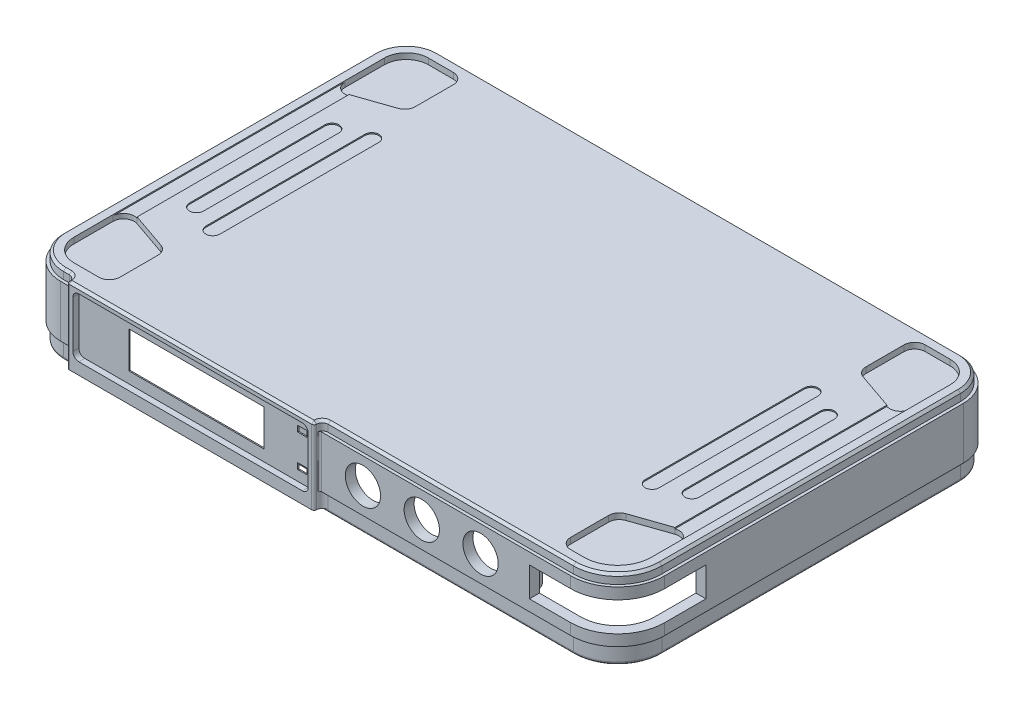
from build123d import *

# Parameters (mm, degrees)
BOSS_EXTRUDE1_DEPTH = 13
CUT_EXTRUDE1_DEPTH  = 1
CUT_EXTRUDE2_DEPTH  = 0.2
CUT_EXTRUDE3_START  = -1.6
CUT_EXTRUDE3_DEPTH  = 1.6
CUT_EXTRUDE4_DEPTH  = 2.6
SKETCH7_W           = 42
SKETCH7_H           = 13
BOSS_EXTRUDE2_DEPTH = 1.4
CUT_EXTRUDE6_DEPTH  = 0.5
CUT_EXTRUDE7_DEPTH  = 1
SKETCH10_R          = 6.5
CUT_EXTRUDE8_DEPTH  = 0.5
FILLET1_R           = 0.4
FILLET2_R           = 1
CHAMFER1_SIZE       = 0.4
CUT_EXTRUDE9_DEPTH  = 11.5
SKETCH12_W          = 23
SKETCH12_H          = 6.2
SKETCH12_W_2        = 1.6
SKETCH12_H_2        = 1
CUT_EXTRUDE10_DEPTH = 12
SKETCH13_R          = 4.5
CUT_EXTRUDE11_DEPTH = 12
SKETCH14_R          = 2.25
CUT_EXTRUDE12_DEPTH = 12
SKETCH15_R          = 3
SKETCH15_W          = 15
SKETCH15_H          = 5
CUT_EXTRUDE13_DEPTH = 15
BOSS_EXTRUDE5_DEPTH = 2.2
SKETCH18_R          = 0.8
SKETCH18_W          = 5.6
SKETCH18_H          = 3
BOSS_EXTRUDE6_DEPTH = 8.5
FILLET4_R           = 0.8
FILLET5_R           = 2
FILLET6_R           = 1
SKETCH19_R          = 0.6
BOSS_EXTRUDE7_DEPTH = 1.4
CHAMFER2_SIZE       = 0.4
SKETCH20_W          = 1.6
SKETCH20_H          = 1
CUT_EXTRUDE14_DEPTH = 1.1
BOSS_EXTRUDE8_DEPTH = 1
BOSS_EXTRUDE9_START = 0.5
BOSS_EXTRUDE9_DEPTH = 0.5
FILLET7_R           = 0.5


# Some blends are built 0.0001 mm under size
with BuildPart() as part:
    # Sketch1 → Boss-Extrude1 (new body)
    with BuildSketch(Plane(origin=(0, 0, 0), x_dir=(1, 0, 0), z_dir=(0, 1, 0))):
        with BuildLine():
            Line((44.35, 32.39), (-44.35, 32.39))
            ThreePointArc((-44.35, 32.39), (-48.592640687, 30.632640687), (-50.35, 26.39))
            Line((-50.35, 26.39), (-50.35, -26.39))
            ThreePointArc((-50.35, -26.39), (-48.592640687, -30.632640687), (-44.35, -32.39))
            Line((-44.35, -32.39), (42.35, -32.39))
            ThreePointArc((42.35, -32.39), (48.006854249, -30.046854249), (50.35, -24.39))
            Line((50.35, -24.39), (50.35, 26.39))
            ThreePointArc((50.35, 26.39), (48.592640687, 30.632640687), (44.35, 32.39))
        make_face()
    extrude(amount=BOSS_EXTRUDE1_DEPTH)

    # Sketch3 → Cut-Extrude1 (cut)
    with BuildSketch(Plane(origin=(0, 13, 0), x_dir=(1, 0, 0), z_dir=(0, 1, 0))):
        with BuildLine():
            Line((-44.35, -30.13894271), (-40.09894271, -30.13894271))
            ThreePointArc((-40.09894271, -30.13894271), (-38.826150504, -29.611734916), (-38.29894271, -28.33894271))
            Line((-38.29894271, -28.33894271), (-38.29894271, -21.854017959))
            ThreePointArc((-38.29894271, -21.854017959), (-38.633270046, -20.809123878), (-39.512057867, -20.152381635))
            Line((-39.512057867, -20.152381635), (-45.712057867, -18.01403634))
            ThreePointArc((-45.712057867, -18.01403634), (-47.343836791, -18.25), (-48.09894271, -19.715672664))
            Line((-48.09894271, -19.715672664), (-48.09894271, -26.39))
            ThreePointArc((-48.09894271, -26.39), (-47.000902813, -29.040902813), (-44.35, -30.13894271))
        make_face()
        with BuildLine():
            ThreePointArc((48.09894271, -24.39), (46.415116375, -28.455116375), (42.35, -30.13894271))
            Line((42.35, -30.13894271), (40.09894271, -30.13894271))
            ThreePointArc((40.09894271, -30.13894271), (38.826150504, -29.611734916), (38.29894271, -28.33894271))
            Line((38.29894271, -28.33894271), (38.29894271, -21.854017959))
            ThreePointArc((38.29894271, -21.854017959), (38.633270046, -20.809123878), (39.512057867, -20.152381635))
            Line((39.512057867, -20.152381635), (45.712057867, -18.01403634))
            ThreePointArc((45.712057867, -18.01403634), (47.343836791, -18.25), (48.09894271, -19.715672664))
            Line((48.09894271, -19.715672664), (48.09894271, -24.39))
        make_face()
        with BuildLine():
            Line((44.35, 30.13894271), (40.09894271, 30.13894271))
            ThreePointArc((40.09894271, 30.13894271), (38.826150504, 29.611734916), (38.29894271, 28.33894271))
            Line((38.29894271, 28.33894271), (38.29894271, 21.854017959))
            ThreePointArc((38.29894271, 21.854017959), (38.633270046, 20.809123878), (39.512057867, 20.152381635))
            Line((39.512057867, 20.152381635), (45.712057867, 18.01403634))
            ThreePointArc((45.712057867, 18.01403634), (47.343836791, 18.25), (48.09894271, 19.715672664))
            Line((48.09894271, 19.715672664), (48.09894271, 26.39))
            ThreePointArc((48.09894271, 26.39), (47.000902813, 29.040902813), (44.35, 30.13894271))
        make_face()
        with BuildLine():
            ThreePointArc((-48.09894271, 26.39), (-47.000902813, 29.040902813), (-44.35, 30.13894271))
            Line((-44.35, 30.13894271), (-40.09894271, 30.13894271))
            ThreePointArc((-40.09894271, 30.13894271), (-38.826150504, 29.611734916), (-38.29894271, 28.33894271))
            Line((-38.29894271, 28.33894271), (-38.29894271, 21.854017959))
            ThreePointArc((-38.29894271, 21.854017959), (-38.633270046, 20.809123878), (-39.512057867, 20.152381635))
            Line((-39.512057867, 20.152381635), (-45.712057867, 18.01403634))
            ThreePointArc((-45.712057867, 18.01403634), (-47.343836791, 18.25), (-48.09894271, 19.715672664))
            Line((-48.09894271, 19.715672664), (-48.09894271, 26.39))
        make_face()
    extrude(amount=-CUT_EXTRUDE1_DEPTH, mode=Mode.SUBTRACT)

    # Sketch4 → Cut-Extrude2 (cut)
    with BuildSketch(Plane(origin=(0, 13, 0), x_dir=(1, 0, 0), z_dir=(0, 1, 0))):
        with BuildLine():
            Line((-48.09894271, 19.715672664), (-48.09894271, -19.715672664))
            ThreePointArc((-48.09894271, -19.715672664), (-47.343836791, -18.25), (-45.712057867, -18.01403634))
            Line((-45.712057867, -18.01403634), (-45.712057867, 18.01403634))
            ThreePointArc((-45.712057867, 18.01403634), (-47.343836791, 18.25), (-48.09894271, 19.715672664))
        make_face()
        with BuildLine():
            Line((-40.925173024, 11.506557578), (-40.925173024, -11.506557578))
            ThreePointArc((-40.925173024, -11.506557578), (-42.118615445, -12.7), (-43.312057867, -11.506557578))
            Line((-43.312057867, -11.506557578), (-43.312057867, 11.506557578))
            ThreePointArc((-43.312057867, 11.506557578), (-42.118615445, 12.7), (-40.925173024, 11.506557578))
        make_face()
        with BuildLine():
            Line((-36.13828818, 13.506557578), (-36.13828818, -13.506557578))
            ThreePointArc((-36.13828818, -13.506557578), (-37.331730602, -14.7), (-38.525173024, -13.506557578))
            Line((-38.525173024, -13.506557578), (-38.525173024, 13.506557578))
            ThreePointArc((-38.525173024, 13.506557578), (-37.331730602, 14.7), (-36.13828818, 13.506557578))
        make_face()
        with BuildLine():
            Line((40.925173024, 11.506557578), (40.925173024, -11.506557578))
            ThreePointArc((40.925173024, -11.506557578), (42.118615445, -12.7), (43.312057867, -11.506557578))
            Line((43.312057867, -11.506557578), (43.312057867, 11.506557578))
            ThreePointArc((43.312057867, 11.506557578), (42.118615445, 12.7), (40.925173024, 11.506557578))
        make_face()
        with BuildLine():
            Line((36.13828818, 13.506557578), (36.13828818, -13.506557578))
            ThreePointArc((36.13828818, -13.506557578), (37.331730602, -14.7), (38.525173024, -13.506557578))
            Line((38.525173024, -13.506557578), (38.525173024, 13.506557578))
            ThreePointArc((38.525173024, 13.506557578), (37.331730602, 14.7), (36.13828818, 13.506557578))
        make_face()
        with BuildLine():
            Line((45.712057867, 18.01403634), (45.712057867, -18.01403634))
            ThreePointArc((45.712057867, -18.01403634), (47.343836791, -18.25), (48.09894271, -19.715672664))
            Line((48.09894271, -19.715672664), (48.09894271, 19.715672664))
            ThreePointArc((48.09894271, 19.715672664), (47.343836791, 18.25), (45.712057867, 18.01403634))
        make_face()
    extrude(amount=-CUT_EXTRUDE2_DEPTH, mode=Mode.SUBTRACT)

    # Sketch5 → Cut-Extrude3 (cut)
    with BuildSketch(Plane(origin=(0, 13, 0), x_dir=(1, 0, 0), z_dir=(0, 1, 0)).offset(CUT_EXTRUDE3_START)):
        with BuildLine():
            Line((44.35, 32.39), (-44.35, 32.39))
            ThreePointArc((-44.35, 32.39), (-48.592640687, 30.632640687), (-50.35, 26.39))
            Line((-50.35, 26.39), (-50.35, -26.39))
            ThreePointArc((-50.35, -26.39), (-48.592640687, -30.632640687), (-44.35, -32.39))
            Line((-44.35, -32.39), (42.35, -32.39))
            ThreePointArc((42.35, -32.39), (48.006854249, -30.046854249), (50.35, -24.39))
            Line((50.35, -24.39), (50.35, 26.39))
            ThreePointArc((50.35, 26.39), (48.592640687, 30.632640687), (44.35, 32.39))
        make_face()
        with BuildLine():
            Line((44.35, 31.89), (-44.35, 31.89))
            ThreePointArc((-44.35, 31.89), (-48.239087297, 30.279087297), (-49.85, 26.39))
            Line((-49.85, 26.39), (-49.85, -26.39))
            ThreePointArc((-49.85, -26.39), (-48.239087297, -30.279087297), (-44.35, -31.89))
            Line((-44.35, -31.89), (42.35, -31.89))
            ThreePointArc((42.35, -31.89), (47.653300859, -29.693300859), (49.85, -24.39))
            Line((49.85, -24.39), (49.85, 26.39))
            ThreePointArc((49.85, 26.39), (48.239087297, 30.279087297), (44.35, 31.89))
        make_face(mode=Mode.SUBTRACT)
    extrude(amount=CUT_EXTRUDE3_DEPTH, mode=Mode.SUBTRACT)

    # Sketch6 → Cut-Extrude4 (cut)
    with BuildSketch(Plane.XZ):
        with BuildLine():
            Line((-44.35, -32.39), (44.35, -32.39))
            ThreePointArc((44.35, -32.39), (48.592640687, -30.632640687), (50.35, -26.39))
            Line((50.35, -26.39), (50.35, 24.39))
            ThreePointArc((50.35, 24.39), (48.006854249, 30.046854249), (42.35, 32.39))
            Line((42.35, 32.39), (-44.35, 32.39))
            ThreePointArc((-44.35, 32.39), (-48.592640687, 30.632640687), (-50.35, 26.39))
            Line((-50.35, 26.39), (-50.35, -26.39))
            ThreePointArc((-50.35, -26.39), (-48.592640687, -30.632640687), (-44.35, -32.39))
        make_face()
        with BuildLine():
            Line((49.85, -26.39), (49.85, 24.39))
            ThreePointArc((49.85, 24.39), (47.653300859, 29.693300859), (42.35, 31.89))
            Line((42.35, 31.89), (-44.35, 31.89))
            ThreePointArc((-44.35, 31.89), (-48.239087297, 30.279087297), (-49.85, 26.39))
            Line((-49.85, 26.39), (-49.85, -26.39))
            ThreePointArc((-49.85, -26.39), (-48.239087297, -30.279087297), (-44.35, -31.89))
            Line((-44.35, -31.89), (44.35, -31.89))
            ThreePointArc((44.35, -31.89), (48.239087297, -30.279087297), (49.85, -26.39))
        make_face(mode=Mode.SUBTRACT)
    extrude(amount=-CUT_EXTRUDE4_DEPTH, mode=Mode.SUBTRACT)

    # Sketch7 → Boss-Extrude2 (add)
    with BuildSketch(Plane.XY.offset(31.89)):
        with Locations((-21.35, 6.5)):
            Rectangle(SKETCH7_W, SKETCH7_H)
    extrude(amount=BOSS_EXTRUDE2_DEPTH)

    # Sketch8 → Cut-Extrude6 (cut)
    with BuildSketch(Plane.ZY.offset(49.85)):
        with BuildLine():
            ThreePointArc((-17.469215611, 11.4), (-15.790490193, 1.50112313), (-7.39, 7))
            ThreePointArc((-7.39, 7), (-7.89112313, 9.400490193), (-9.310784389, 11.4))
            Line((-9.310784389, 11.4), (-17.469215611, 11.4))
        make_face()
        with BuildLine():
            Line((-17.469215611, 11.4), (-9.310784389, 11.4))
            ThreePointArc((-9.310784389, 11.4), (-13.39, 13), (-17.469215611, 11.4))
        make_face()
        with BuildLine():
            ThreePointArc((17.469215611, 11.4), (13.39, 13), (9.310784389, 11.4))
            Line((9.310784389, 11.4), (17.469215611, 11.4))
        make_face()
        with BuildLine():
            Line((17.469215611, 11.4), (9.310784389, 11.4))
            ThreePointArc((9.310784389, 11.4), (10.989509807, 1.50112313), (19.39, 7))
            ThreePointArc((19.39, 7), (18.88887687, 9.400490193), (17.469215611, 11.4))
        make_face()
    extrude(amount=CUT_EXTRUDE6_DEPTH, mode=Mode.SUBTRACT)

    # Sketch9 → Cut-Extrude7 (cut)
    with BuildSketch(Plane.XY.offset(33.29)):
        with BuildLine():
            Line((-40.35, 12), (-2.35, 12))
            ThreePointArc((-2.35, 12), (-1.642893219, 11.707106781), (-1.35, 11))
            Line((-1.35, 11), (-1.35, 3))
            ThreePointArc((-1.35, 3), (-1.642893219, 2.292893219), (-2.35, 2))
            Line((-2.35, 2), (-40.35, 2))
            ThreePointArc((-40.35, 2), (-41.057106781, 2.292893219), (-41.35, 3))
            Line((-41.35, 3), (-41.35, 11))
            ThreePointArc((-41.35, 11), (-41.057106781, 11.707106781), (-40.35, 12))
        make_face()
    extrude(amount=-CUT_EXTRUDE7_DEPTH, mode=Mode.SUBTRACT)

    # Sketch10 → Cut-Extrude8 (cut)
    with BuildSketch(Plane(origin=(0, 0, -31.89), x_dir=(-1, 0, 0), z_dir=(0, 0, -1))):
        with Locations((33.85, 6.5)):
            Circle(SKETCH10_R)
        with BuildLine():
            Line((-23.85, 0), (-34.85, 0))
            ThreePointArc((-34.85, 0), (-41.35, 6.5), (-34.85, 13))
            Line((-34.85, 13), (-23.85, 13))
            ThreePointArc((-23.85, 13), (-17.35, 6.5), (-23.85, 0))
        make_face()
    extrude(amount=CUT_EXTRUDE8_DEPTH, mode=Mode.SUBTRACT)

    # Fillet1
    fillet1_edges = [part.edges().sort_by_distance(p)[0] for p in [
        (-0.35, 7, 32.39),
        (-42.35, 7, 32.39),
        (-0.35, 6.5, 33.29),
        (-42.35, 6.5, 33.29),
    ]]
    fillet(fillet1_edges, radius=FILLET1_R)

    # Fillet2
    fillet2_edges = [part.edges().sort_by_distance(p)[0] for p in [
        (-0.35, 12.2, 31.89),
    ]]
    fillet(fillet2_edges, radius=FILLET2_R - 0.0001)  # a hair under: the kernel refuses the full size
    fillet2_2_edges = [part.edges().sort_by_distance(p)[0] for p in [
        (-42.35, 12.2, 31.89),
    ]]
    fillet(fillet2_2_edges, radius=FILLET2_R - 0.0001)  # a hair under: the kernel refuses the full size

    # Chamfer1
    chamfer1_edges = [part.edges().sort_by_distance(p)[0] for p in [
        (48.239087297, 13, -30.279087297),
        (49.85, 13, -1),
        (47.653300859, 13, 29.693300859),
        (-43.84995, 13, 31.89),
        (-48.239087297, 13, 30.279087297),
        (-49.85, 13, 0),
        (-48.239087297, 13, -30.279087297),
        (0, 13, -31.89),
        (-21.35, 13, 33.29),
        (-0.467157288, 13, 33.172842712),
        (-42.232842712, 13, 33.172842712),
        (21.49995, 13, 31.89),
        (-0.057136071, 13, 32.182863929),
        (-42.642863929, 13, 32.182863929),
    ]]
    chamfer(chamfer1_edges, length=CHAMFER1_SIZE)

    # Sketch11 → Cut-Extrude9 (cut)
    with BuildSketch(Plane.XZ):
        with BuildLine():
            ThreePointArc((-43.35, 30.69), (-42.109032635, 31.073409788), (-41.300609847, 32.09))
            Line((-41.300609847, 32.09), (-1.399390153, 32.09))
            ThreePointArc((-1.399390153, 32.09), (-0.590967365, 31.073409788), (0.65, 30.69))
            Line((0.65, 30.69), (42.35, 30.69))
            ThreePointArc((42.35, 30.69), (46.804772721, 28.844772721), (48.65, 24.39))
            Line((48.65, 24.39), (48.65, -26.39))
            ThreePointArc((48.65, -26.39), (47.390559159, -29.430559159), (44.35, -30.69))
            Line((44.35, -30.69), (-44.35, -30.69))
            ThreePointArc((-44.35, -30.69), (-47.390559159, -29.430559159), (-48.65, -26.39))
            Line((-48.65, -26.39), (-48.65, 26.39))
            ThreePointArc((-48.65, 26.39), (-47.390559159, 29.430559159), (-44.35, 30.69))
            Line((-44.35, 30.69), (-43.35, 30.69))
        make_face()
    extrude(amount=-CUT_EXTRUDE9_DEPTH, mode=Mode.SUBTRACT)

    # Sketch12 → Cut-Extrude10 (cut)
    with BuildSketch(Plane.XY.offset(32.29)):
        with Locations((-21.35, 7)):
            Rectangle(SKETCH12_W, SKETCH12_H)
        with Locations((-3.35, 9.75)):
            Rectangle(SKETCH12_W_2, SKETCH12_H_2)
        with Locations((-3.35, 4.25)):
            Rectangle(SKETCH12_W_2, SKETCH12_H_2)
    extrude(amount=-CUT_EXTRUDE10_DEPTH, mode=Mode.SUBTRACT)

    # Sketch13 → Cut-Extrude11 (cut)
    with BuildSketch(Plane.ZY.offset(49.85)):
        with Locations((-13.39, 7)):
            Circle(SKETCH13_R)
        with Locations((13.39, 7)):
            Circle(SKETCH13_R)
    extrude(amount=-CUT_EXTRUDE11_DEPTH, mode=Mode.SUBTRACT)

    # Sketch14 → Cut-Extrude12 (cut)
    with BuildSketch(Plane(origin=(0, 0, -31.89), x_dir=(-1, 0, 0), z_dir=(0, 0, -1))):
        with Locations((33.85, 6.5)):
            Circle(SKETCH14_R)
        with BuildLine():
            Line((-30.967024337, 9.65), (-21.758292003, 9.65))
            ThreePointArc((-21.758292003, 9.65), (-18.608292003, 6.5), (-21.758292003, 3.35))
            Line((-21.758292003, 3.35), (-30.967024337, 3.35))
            ThreePointArc((-30.967024337, 3.35), (-39.85, 6.5), (-30.967024337, 9.65))
        make_face()
    extrude(amount=-CUT_EXTRUDE12_DEPTH, mode=Mode.SUBTRACT)

    # Sketch15 → Cut-Extrude13 (cut)
    with BuildSketch(Plane.XY.offset(32.39)):
        with Locations((7.05, 7)):
            Circle(SKETCH15_R)
        with Locations((17.05, 7)):
            Circle(SKETCH15_R)
        with Locations((27.05, 7)):
            Circle(SKETCH15_R)
        with Locations((42.85, 7)):
            Rectangle(SKETCH15_W, SKETCH15_H)
    extrude(amount=-CUT_EXTRUDE13_DEPTH, mode=Mode.SUBTRACT)

    # Sketch16 → Boss-Extrude5 (add)
    with BuildSketch(Plane(origin=(-48.65, 0, 0), x_dir=(0, 0, -1), z_dir=(1, 0, 0))):
        with BuildLine():
            Line((-15.89, 11.5), (-19.39, 11.5))
            Line((-19.39, 11.5), (-19.39, 0))
            Line((-19.39, 0), (-7.39, 0))
            Line((-7.39, 0), (-7.39, 11.5))
            Line((-7.39, 11.5), (-10.89, 11.5))
            Line((-10.89, 11.5), (-10.89, 11.472135955))
            ThreePointArc((-10.89, 11.472135955), (-10.759306394, 10.859763519), (-10.39, 10.354101966))
            ThreePointArc((-10.39, 10.354101966), (-9.282080819, 8.837117307), (-8.89, 7))
            ThreePointArc((-8.89, 7), (-15.227117307, 2.892080819), (-16.39, 10.354101966))
            ThreePointArc((-16.39, 10.354101966), (-16.020693606, 10.859763519), (-15.89, 11.472135955))
            Line((-15.89, 11.472135955), (-15.89, 11.5))
        make_face()
        with BuildLine():
            Line((7.39, 11.5), (7.39, 0))
            Line((7.39, 0), (19.39, 0))
            Line((19.39, 0), (19.39, 11.5))
            Line((19.39, 11.5), (15.89, 11.5))
            Line((15.89, 11.5), (15.89, 11.472135955))
            ThreePointArc((15.89, 11.472135955), (16.020693606, 10.859763519), (16.39, 10.354101966))
            ThreePointArc((16.39, 10.354101966), (17.497919181, 8.837117307), (17.89, 7))
            ThreePointArc((17.89, 7), (11.552882693, 2.892080819), (10.39, 10.354101966))
            ThreePointArc((10.39, 10.354101966), (10.759306394, 10.859763519), (10.89, 11.472135955))
            Line((10.89, 11.472135955), (10.89, 11.5))
            Line((10.89, 11.5), (7.39, 11.5))
        make_face()
    extrude(amount=BOSS_EXTRUDE5_DEPTH)

    # Sketch18 → Boss-Extrude6 (add)
    # profile 1 of 6: a face of its own
    with BuildSketch(Plane.XZ.offset(-11.5)):
        with BuildLine():
            Line((-42.35, 31.19), (-44.35, 31.19))
            ThreePointArc((-44.35, 31.19), (-47.74411255, 29.78411255), (-49.15, 26.39))
            Line((-49.15, 26.39), (-49.15, 24.39))
            Line((-49.15, 24.39), (-44.35, 24.39))
            ThreePointArc((-44.35, 24.39), (-42.935786438, 24.975786438), (-42.35, 26.39))
            Line((-42.35, 26.39), (-42.35, 31.19))
        make_face()
        with Locations(Location((-45, 27.04, 0), (0, 0, 270))):
            Circle(SKETCH18_R, mode=Mode.SUBTRACT)
    # profile 2 of 6: a face of its own
    with BuildSketch(Plane.XZ.offset(-11.5)):
        with BuildLine():
            Line((-44.35, -24.39), (-49.15, -24.39))
            Line((-49.15, -24.39), (-49.15, -26.39))
            ThreePointArc((-49.15, -26.39), (-47.74411255, -29.78411255), (-44.35, -31.19))
            Line((-44.35, -31.19), (-42.35, -31.19))
            Line((-42.35, -31.19), (-42.35, -26.39))
            ThreePointArc((-42.35, -26.39), (-42.935786438, -24.975786438), (-44.35, -24.39))
        make_face()
        with Locations(Location((-45, -27.04, 0), (0, 0, 90))):
            Circle(SKETCH18_R, mode=Mode.SUBTRACT)
    # profile 3 of 6: a face of its own
    with BuildSketch(Plane.XZ.offset(-11.5)):
        with BuildLine():
            Line((42.35, -31.19), (44.35, -31.19))
            ThreePointArc((44.35, -31.19), (47.74411255, -29.78411255), (49.15, -26.39))
            Line((49.15, -26.39), (49.15, -24.39))
            Line((49.15, -24.39), (44.35, -24.39))
            ThreePointArc((44.35, -24.39), (42.935786438, -24.975786438), (42.35, -26.39))
            Line((42.35, -26.39), (42.35, -31.19))
        make_face()
        with Locations(Location((45, -27.04, 0), (0, 0, 270))):
            Circle(SKETCH18_R, mode=Mode.SUBTRACT)
    # profile 4 of 6: a face of its own
    with BuildSketch(Plane.XZ.offset(-11.5)):
        Polygon((-8.35, 30.69), (0.85, 30.69), (0.85, 28.49), (-1.15, 28.49), (-1.15, 29.59), (-6.35, 29.59), (-6.35, 28.49), (-8.35, 28.49), align=None)
    # profile 5 of 6: a face of its own
    with BuildSketch(Plane.XZ.offset(-11.5)):
        with BuildLine():
            Line((33.35, 30.69), (33.35, 29.49))
            ThreePointArc((33.35, 29.49), (32.383452378, 27.156547622), (30.05, 26.19))
            Line((30.05, 26.19), (28.35, 26.19))
            Line((28.35, 26.19), (28.35, 27.49))
            Line((28.35, 27.49), (30.05, 27.49))
            ThreePointArc((30.05, 27.49), (31.464213562, 28.075786438), (32.05, 29.49))
            Line((32.05, 29.49), (32.05, 30.69))
            Line((32.05, 30.69), (33.35, 30.69))
        make_face()
    # profile 6 of 6: a face of its own
    with BuildSketch(Plane.XZ.offset(-11.5)):
        with Locations((45.85, 9.49)):
            Rectangle(SKETCH18_W, SKETCH18_H)
    extrude(amount=BOSS_EXTRUDE6_DEPTH)

    # Fillet4
    fillet4_edges = [part.edges().sort_by_distance(p)[0] for p in [
        (0.65, 7.25, 30.69),
    ]]
    fillet(fillet4_edges, radius=FILLET4_R)

    # Fillet5
    # the kernel refuses this fillet: 2 mm, written as the material it adds along each edge
    with BuildSketch(Plane(origin=(48.65, 16.5, -24.39), x_dir=(0, 0, 1), z_dir=(0, -1, 0))) as fillet5_piece_1_section:
        with BuildLine():
            CenterArc((FILLET5_R, FILLET5_R), FILLET5_R, 180, 90)
            Line((0, FILLET5_R), (0, 0))
            Line((0, 0), (FILLET5_R, 0))
        make_face()
    fillet5_piece_1 = extrude(amount=13.5, mode=Mode.PRIVATE)
    fillet5_piece_1 = split(fillet5_piece_1, bisect_by=Plane(origin=(48.65, 12, -24.39), z_dir=(0, -1, 0)), keep=Keep.TOP, mode=Mode.PRIVATE)
    add(fillet5_piece_1)
    with BuildSketch(Plane(origin=(42.35, 3, -30.69), x_dir=(0, 0, 1), z_dir=(0, 1, 0))) as fillet5_piece_2_section:
        with BuildLine():
            CenterArc((FILLET5_R, -FILLET5_R), FILLET5_R, 90, 90)
            Line((0, -FILLET5_R), (0, 0))
            Line((0, 0), (FILLET5_R, 0))
        make_face()
    fillet5_piece_2 = extrude(amount=13.5, mode=Mode.PRIVATE)
    fillet5_piece_2 = split(fillet5_piece_2, bisect_by=Plane(origin=(42.35, 12, -30.69), z_dir=(0, -1, 0)), keep=Keep.TOP, mode=Mode.PRIVATE)
    add(fillet5_piece_2)
    with BuildSketch(Plane(origin=(-42.35, 16.5, -30.69), x_dir=(1, 0, 0), z_dir=(0, -1, 0))) as fillet5_piece_3_section:
        with BuildLine():
            CenterArc((FILLET5_R, FILLET5_R), FILLET5_R, 180, 90)
            Line((0, FILLET5_R), (0, 0))
            Line((0, 0), (FILLET5_R, 0))
        make_face()
    fillet5_piece_3 = extrude(amount=13.5, mode=Mode.PRIVATE)
    fillet5_piece_3 = split(fillet5_piece_3, bisect_by=Plane(origin=(-42.35, 12, -30.69), z_dir=(0, -1, 0)), keep=Keep.TOP, mode=Mode.PRIVATE)
    add(fillet5_piece_3)
    with BuildSketch(Plane(origin=(-48.65, 3, -24.39), x_dir=(0, 0, 1), z_dir=(0, 1, 0))) as fillet5_piece_4_section:
        with BuildLine():
            CenterArc((FILLET5_R, FILLET5_R), FILLET5_R, 180, 90)
            Line((0, FILLET5_R), (0, 0))
            Line((0, 0), (FILLET5_R, 0))
        make_face()
    fillet5_piece_4 = extrude(amount=13.5, mode=Mode.PRIVATE)
    fillet5_piece_4 = split(fillet5_piece_4, bisect_by=Plane(origin=(-48.65, 12, -24.39), z_dir=(0, -1, 0)), keep=Keep.TOP, mode=Mode.PRIVATE)
    add(fillet5_piece_4)
    with BuildSketch(Plane(origin=(-48.65, 16.5, 24.39), x_dir=(1, 0, 0), z_dir=(0, -1, 0))) as fillet5_piece_5_section:
        with BuildLine():
            CenterArc((FILLET5_R, -FILLET5_R), FILLET5_R, 90, 90)
            Line((0, -FILLET5_R), (0, 0))
            Line((0, 0), (FILLET5_R, 0))
        make_face()
    fillet5_piece_5 = extrude(amount=13.5, mode=Mode.PRIVATE)
    fillet5_piece_5 = split(fillet5_piece_5, bisect_by=Plane(origin=(-48.65, 12, 24.39), z_dir=(0, -1, 0)), keep=Keep.TOP, mode=Mode.PRIVATE)
    add(fillet5_piece_5)
    with BuildSketch(Plane(origin=(-42.35, 13.949489743, 30.930408206), x_dir=(0.8058229640253751, 0, 0.592156525463799), z_dir=(0, -1, 0))) as fillet5_piece_6_section:
        with BuildLine():
            CenterArc((1.031453394, -1.973855085), FILLET5_R, 99.274499807, 44.415308597)
            Line((-0.580192534, -0.789542034), (0, 0))
            ThreePointArc((0, 0), (0.354562104, -0.028759407), (0.709124208, 0))
        make_face()
    fillet5_piece_6 = extrude(amount=10.949489743, mode=Mode.PRIVATE)
    fillet5_piece_6 = split(fillet5_piece_6, bisect_by=Plane(origin=(-42.35, 12, 30.930408206), z_dir=(0, -1, 0)), keep=Keep.TOP, mode=Mode.PRIVATE)
    add(fillet5_piece_6)
    with BuildSketch(Plane(origin=(48.65, 16.5, 7.99), x_dir=(0, 0, -1), z_dir=(0, -1, 0))) as fillet5_piece_7_section:
        with BuildLine():
            CenterArc((FILLET5_R, -FILLET5_R), FILLET5_R, 90, 90)
            Line((0, -FILLET5_R), (0, 0))
            Line((0, 0), (FILLET5_R, 0))
        make_face()
    fillet5_piece_7 = extrude(amount=13.5, mode=Mode.PRIVATE)
    fillet5_piece_7 = split(fillet5_piece_7, bisect_by=Plane(origin=(48.65, 12.8, 7.99), z_dir=(0, -1, 0)), keep=Keep.TOP, mode=Mode.PRIVATE)
    add(fillet5_piece_7)
    with BuildSketch(Plane(origin=(48.65, 16.5, 10.99), x_dir=(0, 0, 1), z_dir=(0, -1, 0))) as fillet5_piece_8_section:
        with BuildLine():
            CenterArc((FILLET5_R, FILLET5_R), FILLET5_R, 180, 90)
            Line((0, FILLET5_R), (0, 0))
            Line((0, 0), (FILLET5_R, 0))
        make_face()
    fillet5_piece_8 = extrude(amount=13.5, mode=Mode.PRIVATE)
    fillet5_piece_8 = split(fillet5_piece_8, bisect_by=Plane(origin=(48.65, 12.8, 10.99), z_dir=(0, -1, 0)), keep=Keep.TOP, mode=Mode.PRIVATE)
    add(fillet5_piece_8)
    with BuildSketch(Plane(origin=(33.35, 16.348186897, 30.69), x_dir=(1, 0, 0), z_dir=(0, -1, 0))) as fillet5_piece_9_section:
        with BuildLine():
            CenterArc((1.939274759, -2), FILLET5_R, 90, 81.318398303)
            Line((-0.037810056, -1.698113208), (-0.235518537, -1.667924528))
            ThreePointArc((-0.235518537, -1.667924528), (-0.2, -1.2), (-0.2, 0))
            Line((-0.2, 0), (0, 0.2))
            Line((0, 0.2), (1.939274759, 0.2))
            Line((1.939274759, 0.2), (1.939274759, 0))
        make_face()
    fillet5_piece_9 = extrude(amount=13.348186897, mode=Mode.PRIVATE)
    fillet5_piece_9 = split(fillet5_piece_9, bisect_by=Plane(origin=(33.35, 13, 30.69), z_dir=(0, -1, 0)), keep=Keep.TOP, mode=Mode.PRIVATE)
    add(fillet5_piece_9)
    with BuildSketch(Plane(origin=(32.05, 16.082575695, 30.69), x_dir=(-1, 0, 0), z_dir=(0, -1, 0))) as fillet5_piece_10_section:
        with BuildLine():
            CenterArc((1.833030278, 2), FILLET5_R, 203.578178478, 66.421821522)
            Line((0, 1.2), (0, 0))
            Line((0, 0), (1.833030278, 0))
        make_face()
    fillet5_piece_10 = extrude(amount=13.082575695, mode=Mode.PRIVATE)
    fillet5_piece_10 = split(fillet5_piece_10, bisect_by=Plane(origin=(32.05, 13, 30.69), z_dir=(0, -1, 0)), keep=Keep.TOP, mode=Mode.PRIVATE)
    add(fillet5_piece_10)
    with BuildSketch(Plane(origin=(0.85, 16.5, 30.69), x_dir=(1, 0, 0), z_dir=(0, -1, 0))) as fillet5_piece_11_section:
        with BuildLine():
            CenterArc((FILLET5_R, -FILLET5_R), FILLET5_R, 90, 90)
            Line((0, -FILLET5_R), (0, 0))
            Line((0, 0), (FILLET5_R, 0))
        make_face()
    fillet5_piece_11 = extrude(amount=13.5, mode=Mode.PRIVATE)
    fillet5_piece_11 = split(fillet5_piece_11, bisect_by=Plane(origin=(0.85, 13, 30.69), z_dir=(0, -1, 0)), keep=Keep.TOP, mode=Mode.PRIVATE)
    add(fillet5_piece_11)

    # Fillet6
    fillet6_edges = [part.edges().sort_by_distance(p)[0] for p in [
        (43.05, 7.25, 10.99),
        (43.05, 7.25, 7.99),
    ]]
    fillet(fillet6_edges, radius=FILLET6_R)

    # Sketch19 → Boss-Extrude7 (add)
    with BuildSketch(Plane.XZ.offset(-3)):
        with Locations(Location((45, 9.49, 0), (0, 0, 90))):
            Circle(SKETCH19_R)
    extrude(amount=BOSS_EXTRUDE7_DEPTH)

    # Chamfer2
    chamfer2_edges = [part.edges().sort_by_distance(p)[0] for p in [
        (45, 1.6, 8.89),
    ]]
    chamfer(chamfer2_edges, length=CHAMFER2_SIZE)

    # Sketch20 → Cut-Extrude14 (cut)
    with BuildSketch(Plane(origin=(0, 0, 29.59), x_dir=(-1, 0, 0), z_dir=(0, 0, -1))):
        with Locations((3.35, 4.25)):
            Rectangle(SKETCH20_W, SKETCH20_H)
        with Locations((3.35, 9.75)):
            Rectangle(SKETCH20_W, SKETCH20_H)
    extrude(amount=-CUT_EXTRUDE14_DEPTH, mode=Mode.SUBTRACT)

    # Sketch21 → Boss-Extrude8 (add)
    with BuildSketch(Plane.XZ):
        with BuildLine():
            Line((0.65, 31.89), (0.65, 30.69))
            Line((0.65, 30.69), (-43.35, 30.69))
            Line((-43.35, 30.69), (-43.35, 31.89))
            ThreePointArc((-43.35, 31.89), (-42.642893219, 32.182893219), (-42.35, 32.89))
            ThreePointArc((-42.35, 32.89), (-42.232842712, 33.172842712), (-41.95, 33.29))
            Line((-41.95, 33.29), (-0.75, 33.29))
            ThreePointArc((-0.75, 33.29), (-0.467157288, 33.172842712), (-0.35, 32.89))
            ThreePointArc((-0.35, 32.89), (-0.057106781, 32.182893219), (0.65, 31.89))
        make_face()
    extrude(amount=-BOSS_EXTRUDE8_DEPTH)

    # Sketch22 → Boss-Extrude9 (add)
    with BuildSketch(Plane.XZ.offset(BOSS_EXTRUDE9_START)):
        with BuildLine():
            Line((-49.85, 26.39), (-49.85, -26.39))
            ThreePointArc((-49.85, -26.39), (-48.239087297, -30.279087297), (-44.35, -31.89))
            Line((-44.35, -31.89), (44.35, -31.89))
            ThreePointArc((44.35, -31.89), (48.239087297, -30.279087297), (49.85, -26.39))
            Line((49.85, -26.39), (49.85, 24.39))
            ThreePointArc((49.85, 24.39), (47.653300859, 29.693300859), (42.35, 31.89))
            Line((42.35, 31.89), (-44.35, 31.89))
            ThreePointArc((-44.35, 31.89), (-48.239087297, 30.279087297), (-49.85, 26.39))
        make_face()
        with BuildLine():
            Line((42.35, 30.858865334), (-44.35, 30.858865334))
            ThreePointArc((-44.35, 30.858865334), (-47.509964982, 29.549964982), (-48.818865334, 26.39))
            Line((-48.818865334, 26.39), (-48.818865334, -26.39))
            ThreePointArc((-48.818865334, -26.39), (-47.509964982, -29.549964982), (-44.35, -30.858865334))
            Line((-44.35, -30.858865334), (44.35, -30.858865334))
            ThreePointArc((44.35, -30.858865334), (47.509964982, -29.549964982), (48.818865334, -26.39))
            Line((48.818865334, -26.39), (48.818865334, 24.39))
            ThreePointArc((48.818865334, 24.39), (46.924178544, 28.964178544), (42.35, 30.858865334))
        make_face(mode=Mode.SUBTRACT)
    extrude(amount=-BOSS_EXTRUDE9_DEPTH)

    # Fillet7
    fillet7_edges = [part.edges().sort_by_distance(p)[0] for p in [
        (-48.239087297, -0.5, 30.279087297),
        (-49.85, -0.5, 0),
        (-48.239087297, -0.5, -30.279087297),
        (0, -0.5, -31.89),
        (48.239087297, -0.5, -30.279087297),
        (49.85, -0.5, -1),
        (47.653300859, -0.5, 29.693300859),
        (-1, -0.5, 31.89),
    ]]
    fillet(fillet7_edges, radius=FILLET7_R - 0.0001)  # a hair under: the kernel refuses the full size


solid = part.part
